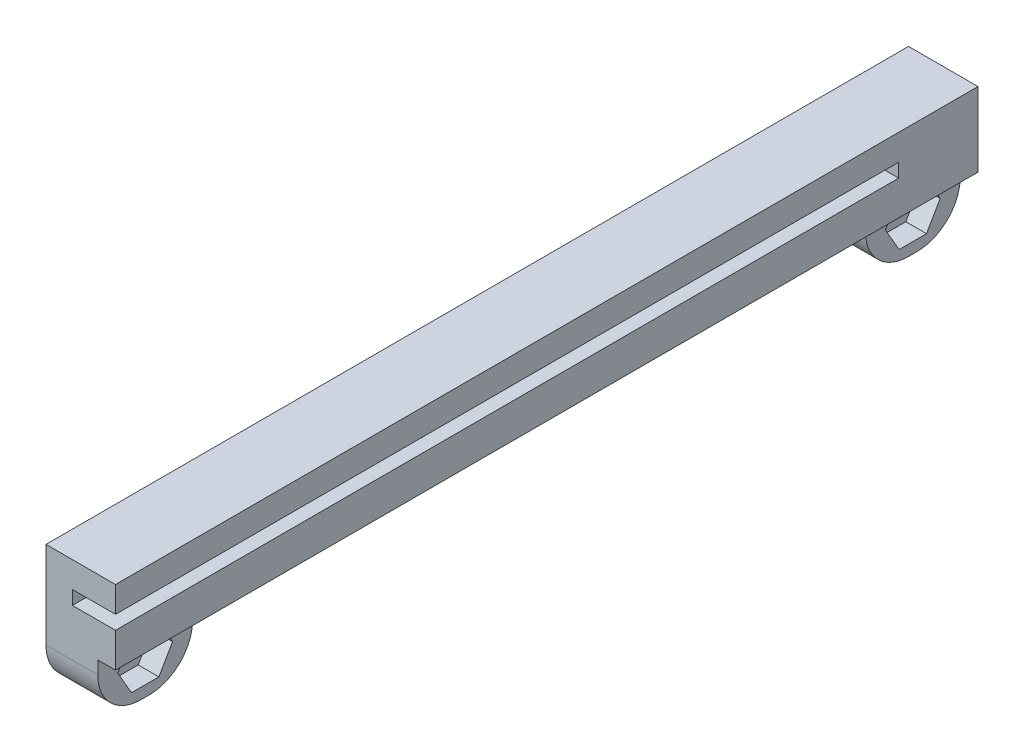
from build123d import *
from build123d.topology import SkipClean

# Parameters (mm, degrees)
SKETCH1_W           = 7.0575
SKETCH1_H           = 100
BOSS_EXTRUDE2_DEPTH = 7.6
SKETCH4_W           = 5
SKETCH4_H           = 90.805
CUT_EXTRUDE1_DEPTH  = 4.6
SKETCH6_W           = 5
SKETCH6_H           = 90.805
BOSS_EXTRUDE3_DEPTH = 3
SKETCH8_W           = 7.0575
SKETCH8_H           = 100
BOSS_EXTRUDE4_DEPTH = 1
SKETCH9_W           = 5
SKETCH9_H           = 11
BOSS_EXTRUDE5_DEPTH = 6.5
CUT_EXTRUDE2_DEPTH  = 2.4
SKETCH11_R          = 1.5
CUT_EXTRUDE3_DEPTH  = 51.77035854
FILLET2_R           = 5
SKETCH13_R          = 1.5
BOSS_EXTRUDE6_DEPTH = 1


with BuildPart() as part:
    # Sketch1 → Boss-Extrude2 (new body)
    with BuildSketch(Plane(origin=(0, 0, 0), x_dir=(1, 0, 0), z_dir=(0, 1, 0))):
        Rectangle(SKETCH1_W, SKETCH1_H)
    extrude(amount=BOSS_EXTRUDE2_DEPTH)

    # Sketch4 → Cut-Extrude1 (cut)
    with BuildSketch(Plane(origin=(0, 7.6, 0), x_dir=(1, 0, 0), z_dir=(0, 1, 0))):
        with Locations((1.02875, -4.5975)):
            Rectangle(SKETCH4_W, SKETCH4_H)
    extrude(amount=-CUT_EXTRUDE1_DEPTH, mode=Mode.SUBTRACT)

    # Sketch6 → Boss-Extrude3 (add)
    with BuildSketch(Plane(origin=(0, 7.6, 0), x_dir=(1, 0, 0), z_dir=(0, 1, 0))):
        with Locations((1.02875, -4.5975)):
            Rectangle(SKETCH6_W, SKETCH6_H)
    extrude(amount=-BOSS_EXTRUDE3_DEPTH)

    # Sketch8 → Boss-Extrude4 (add)
    with BuildSketch(Plane.XZ):
        Rectangle(SKETCH8_W, SKETCH8_H)
    extrude(amount=BOSS_EXTRUDE4_DEPTH)

    # Sketch9 → Boss-Extrude5 (add)
    with BuildSketch(Plane.XZ.offset(1)):
        with Locations((-1.02875, 44.5)):
            Rectangle(SKETCH9_W, SKETCH9_H)
        with Locations((-1.02875, -44.5)):
            Rectangle(SKETCH9_W, SKETCH9_H)
    extrude(amount=BOSS_EXTRUDE5_DEPTH)

    # Sketch10 → Cut-Extrude2 (cut)
    with BuildSketch(Plane(origin=(1.47125, 0, 0), x_dir=(0, 0, -1), z_dir=(1, 0, 0))):
        Polygon((-46.08771324, -0.75), (-47.675426481, -3.5), (-46.08771324, -6.25), (-42.91228676, -6.25), (-41.324573519, -3.5), (-42.91228676, -0.75), align=None)
        Polygon((47.675426481, -3.5), (46.08771324, -0.75), (42.91228676, -0.75), (41.324573519, -3.5), (42.91228676, -6.25), (46.08771324, -6.25), align=None)
    extrude(amount=-CUT_EXTRUDE2_DEPTH, mode=Mode.SUBTRACT)

    # Sketch11 → Cut-Extrude3 (cut, through all)
    with BuildSketch(Plane(origin=(-0.92875, 0, 0), x_dir=(0, 0, -1), z_dir=(1, 0, 0))):
        with Locations((-44.5, -3.5)):
            Circle(SKETCH11_R)
        with Locations((44.5, -3.5)):
            Circle(SKETCH11_R)
    extrude(amount=-CUT_EXTRUDE3_DEPTH, mode=Mode.SUBTRACT)

    # Fillet2
    fillet2_edges = [part.edges().sort_by_distance(p)[0] for p in [
        (-1.02875, -7.5, -50),
        (-1.02875, -7.5, -39),
        (-1.02875, -7.5, 39),
        (-1.02875, -7.5, 50),
    ]]
    fillet(fillet2_edges, radius=FILLET2_R)

    # Sketch13 → Boss-Extrude6 (add)
    with SkipClean():  # the faces are left unmerged after this step: merging them gives an invalid solid
        with BuildSketch(Plane.ZY.offset(3.52875)):
            with BuildLine():
                Line((-45, -7.5), (-44, -7.5))
                ThreePointArc((-44, -7.5), (-40.464466094, -6.035533906), (-39, -2.5))
                Line((-39, -2.5), (-39, -1))
                Line((-39, -1), (39, -1))
                Line((39, -1), (39, -2.5))
                ThreePointArc((39, -2.5), (40.464466094, -6.035533906), (44, -7.5))
                Line((44, -7.5), (45, -7.5))
                ThreePointArc((45, -7.5), (48.535533906, -6.035533906), (50, -2.5))
                Line((50, -2.5), (50, 7.6))
                Line((50, 7.6), (-50, 7.6))
                Line((-50, 7.6), (-50, -2.5))
                ThreePointArc((-50, -2.5), (-48.535533906, -6.035533906), (-45, -7.5))
            make_face()
            with Locations((-44.5, -3.5)):
                Circle(SKETCH13_R, mode=Mode.SUBTRACT)
            with Locations((44.5, -3.5)):
                Circle(SKETCH13_R, mode=Mode.SUBTRACT)
        extrude(amount=BOSS_EXTRUDE6_DEPTH)


solid = part.part
